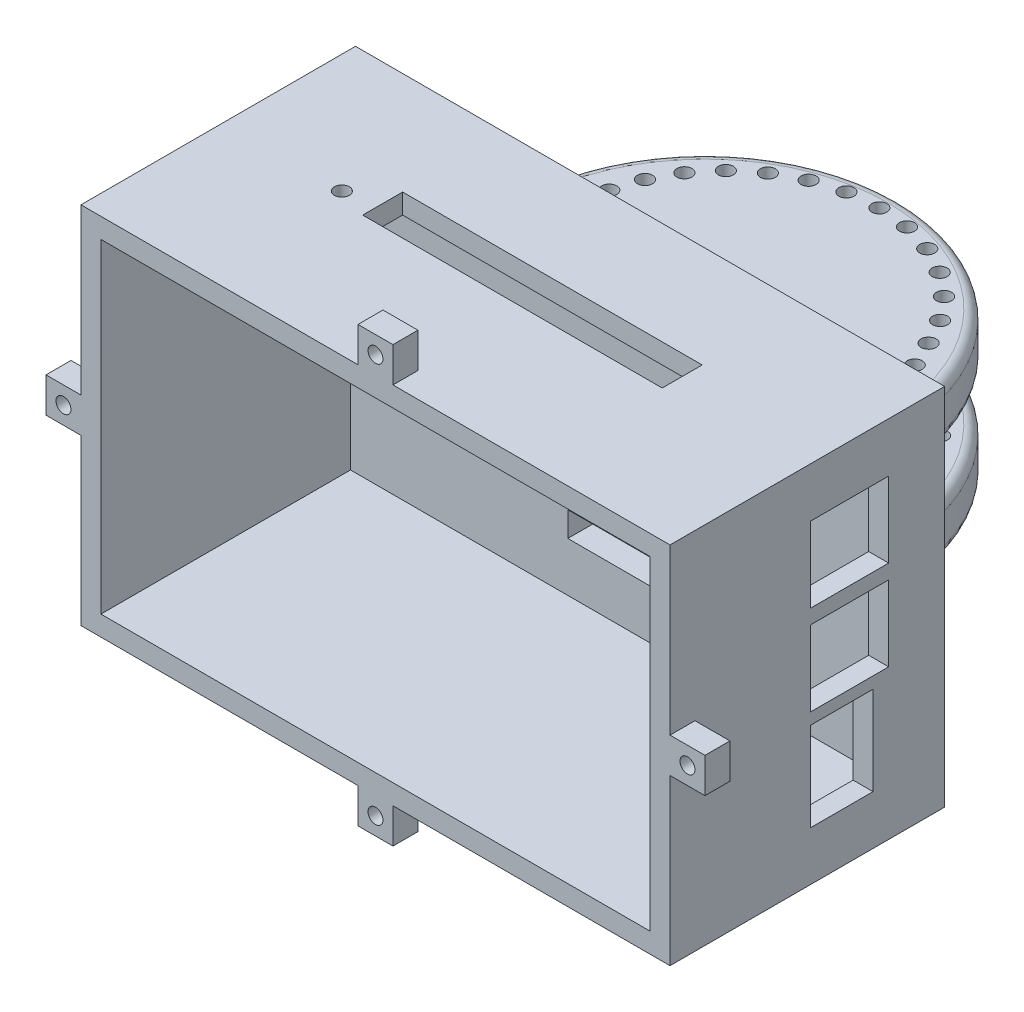
from build123d import *

# Parameters (mm, degrees)
CROQUIS1_W                    = 118
CROQUIS1_H                    = 73
SALIENTE_EXTRUIR1_DEPTH       = 100
SALIENTE_EXTRUIR2_START       = -86
SALIENTE_EXTRUIR2_OUTLINE_W   = 110
SALIENTE_EXTRUIR2_OUTLINE_H   = 65
SALIENTE_EXTRUIR2_DEPTH       = 86
SALIENTE_EXTRUIR3_START       = -9.489193536
SALIENTE_EXTRUIR3_OUTLINE_R   = 1.5
SALIENTE_EXTRUIR3_OUTLINE_R_2 = 11
SALIENTE_EXTRUIR3_DEPTH       = 9.489193536
CROQUIS4_W                    = 7
CROQUIS4_H                    = 7
CROQUIS4_R                    = 1.5
SALIENTE_EXTRUIR4_DEPTH       = 5
SALIENTE_EXTRUIR5_START       = -4
SALIENTE_EXTRUIR5_OUTLINE_W   = 12.57
SALIENTE_EXTRUIR5_OUTLINE_H   = 17.78
SALIENTE_EXTRUIR5_OUTLINE_W_2 = 15.7
SALIENTE_EXTRUIR5_OUTLINE_H_2 = 15.1
SALIENTE_EXTRUIR5_DEPTH       = 4
CROQUIS7_R                    = 1.5
CROQUIS7_W                    = 60
CROQUIS7_H                    = 8
CORTAR_EXTRUIR1_DEPTH         = 10
CROQUIS13_W                   = 50
CROQUIS13_H                   = 73
CORTAR_EXTRUIR3_DEPTH         = 135
CROQUIS14_W                   = 5
CROQUIS14_H                   = 73
SALIENTE_EXTRUIR8_DEPTH       = 118
SALIENTE_EXTRUIR9_DEPTH       = 15
SALIENTE_EXTRUIR9_DEPTH_BACK  = 15
CROQUIS16_R                   = 1.5
CORTAR_EXTRUIR4_DEPTH         = 5
CORTAR_EXTRUIR4_DEPTH_BACK    = 5
CROQUIS16_3_R                 = 1.5
REDONDEO4_R                   = 2
SALIENTE_EXTRUIR10_START      = -5
SALIENTE_EXTRUIR10_OUTLINE_W  = 20
SALIENTE_EXTRUIR10_OUTLINE_H  = 5
SALIENTE_EXTRUIR10_DEPTH      = 5


# Read off the part's stored shape, not the designer's step: Saliente-Extruir2, Saliente-Extruir3, Saliente-Extruir5, Saliente-Extruir10
with BuildPart() as part:
    # Croquis1 → Saliente-Extruir1 (new body)
    with BuildSketch(Plane(origin=(0, 6.22367504, 0), x_dir=(1, 0, 0), z_dir=(0, 0, 1))):
        with Locations((1.479192938, -15.901008827)):
            Rectangle(CROQUIS1_W, CROQUIS1_H)
    extrude(amount=SALIENTE_EXTRUIR1_DEPTH)

    # Saliente-Extruir2 outline → Saliente-Extruir2 (cut)
    with BuildSketch(Plane(origin=(0, 6.22367504, 100), x_dir=(1, 0, 0), z_dir=(0, 0, 1)).offset(SALIENTE_EXTRUIR2_START)):
        with Locations((1.479192938, -15.901008827)):
            Rectangle(SALIENTE_EXTRUIR2_OUTLINE_W, SALIENTE_EXTRUIR2_OUTLINE_H)
    extrude(amount=SALIENTE_EXTRUIR2_DEPTH, mode=Mode.SUBTRACT)

    # Saliente-Extruir3 outline → Saliente-Extruir3 (cut)
    with BuildSketch(Plane(origin=(0, 6.22367504, 0), x_dir=(-1, 0, 0), z_dir=(0, 0, -1)).offset(SALIENTE_EXTRUIR3_START)):
        with Locations((-16.979192938, -0.401008827)):
            Circle(SALIENTE_EXTRUIR3_OUTLINE_R)
        with Locations((14.020807062, -0.401008827)):
            Circle(SALIENTE_EXTRUIR3_OUTLINE_R)
        with Locations((-1.479192938, -15.901008827)):
            Circle(SALIENTE_EXTRUIR3_OUTLINE_R_2)
        with Locations((14.020807062, -31.401008827)):
            Circle(SALIENTE_EXTRUIR3_OUTLINE_R)
        with Locations((-16.979192938, -31.401008827)):
            Circle(SALIENTE_EXTRUIR3_OUTLINE_R)
    extrude(amount=SALIENTE_EXTRUIR3_DEPTH, mode=Mode.SUBTRACT)

    # Croquis4 → Saliente-Extruir4 (add)
    # profile 1 of 4: a face of its own
    with BuildSketch(Plane(origin=(0, 6.22367504, 100), x_dir=(1, 0, 0), z_dir=(0, 0, 1))):
        with Locations((1.479192938, 24.098991173)):
            Rectangle(CROQUIS4_W, CROQUIS4_H)
        with Locations((1.479192938, 24.098991173)):
            Circle(CROQUIS4_R, mode=Mode.SUBTRACT)
    # profile 2 of 4: a face of its own
    with BuildSketch(Plane(origin=(0, 6.22367504, 100), x_dir=(1, 0, 0), z_dir=(0, 0, 1))):
        with Locations((-61.020807062, -15.901008827)):
            Rectangle(CROQUIS4_W, CROQUIS4_H)
        with Locations((-61.020807062, -15.901008827)):
            Circle(CROQUIS4_R, mode=Mode.SUBTRACT)
    # profile 3 of 4: a face of its own
    with BuildSketch(Plane(origin=(0, 6.22367504, 100), x_dir=(1, 0, 0), z_dir=(0, 0, 1))):
        with Locations((1.479192938, -55.901008827)):
            Rectangle(CROQUIS4_W, CROQUIS4_H)
        with Locations((1.479192938, -55.901008827)):
            Circle(CROQUIS4_R, mode=Mode.SUBTRACT)
    # profile 4 of 4: a face of its own
    with BuildSketch(Plane(origin=(0, 6.22367504, 100), x_dir=(1, 0, 0), z_dir=(0, 0, 1))):
        with Locations((63.979192938, -15.901008827)):
            Rectangle(CROQUIS4_W, CROQUIS4_H)
        with Locations((63.979192938, -15.901008827)):
            Circle(CROQUIS4_R, mode=Mode.SUBTRACT)
    extrude(amount=-SALIENTE_EXTRUIR4_DEPTH)

    # Saliente-Extruir5 outline → Saliente-Extruir5 (cut)
    with BuildSketch(Plane(origin=(60.479192938, 6.22367504, 0), x_dir=(0, 0, -1), z_dir=(1, 0, 0)).offset(SALIENTE_EXTRUIR5_START)):
        with Locations((-65.615, -33.651008827)):
            Rectangle(SALIENTE_EXTRUIR5_OUTLINE_W, SALIENTE_EXTRUIR5_OUTLINE_H)
        with Locations((-64.05, -14.901008827)):
            Rectangle(SALIENTE_EXTRUIR5_OUTLINE_W_2, SALIENTE_EXTRUIR5_OUTLINE_H_2)
        with Locations((-64.05, 3.098991173)):
            Rectangle(SALIENTE_EXTRUIR5_OUTLINE_W_2, SALIENTE_EXTRUIR5_OUTLINE_H_2)
    extrude(amount=SALIENTE_EXTRUIR5_DEPTH, mode=Mode.SUBTRACT)

    # Croquis7 → Cortar-Extruir1 (cut)
    with BuildSketch(Plane(origin=(0, 26.822666212, 0), x_dir=(1, 0, 0), z_dir=(0, 1, 0))):
        with Locations(Location((-33.770807062, -71.48, 0), (0, 0, 270))):
            Circle(CROQUIS7_R)
        with Locations((2.479192938, -69.56)):
            Rectangle(CROQUIS7_W, CROQUIS7_H)
    extrude(amount=-CORTAR_EXTRUIR1_DEPTH, mode=Mode.SUBTRACT)

    # Croquis13 → Cortar-Extruir3 (cut)
    with BuildSketch(Plane(origin=(60.479192938, 6.22367504, 0), x_dir=(0, 0, -1), z_dir=(1, 0, 0))):
        with Locations((-25, -15.901008827)):
            Rectangle(CROQUIS13_W, CROQUIS13_H)
    extrude(amount=-CORTAR_EXTRUIR3_DEPTH, mode=Mode.SUBTRACT)

    # Croquis14 → Saliente-Extruir8 (add)
    with BuildSketch(Plane(origin=(60.479192938, 6.22367504, 0), x_dir=(0, 0, -1), z_dir=(1, 0, 0))):
        with Locations((-47.5, -15.901008827)):
            Rectangle(CROQUIS14_W, CROQUIS14_H)
    extrude(amount=-SALIENTE_EXTRUIR8_DEPTH)

    # Croquis16 → Saliente-Extruir9 (add, two sides: drawn at the far end of the back side and taken through both)
    with BuildSketch(Plane(origin=(0, -9.677333788, 0), x_dir=(1, 0, 0), z_dir=(0, 1, 0)).offset(-SALIENTE_EXTRUIR9_DEPTH_BACK)):
        with BuildLine():
            Line((-35.601799497, -45), (38.560185374, -45))
            ThreePointArc((38.560185374, -45), (1.479192938, 4.678159212), (-35.601799497, -45))
        make_face()
        with Locations(Location((1.479192938, -34, 0), (0, 0, 270))):
            Circle(CROQUIS16_R, mode=Mode.SUBTRACT)
        with Locations(Location((34.26638556, -34, 0), (0, 0, 270))):
            Circle(CROQUIS16_R, mode=Mode.SUBTRACT)
        with Locations(Location((33.768274431, -28.30656375, 0), (0, 0, 270))):
            Circle(CROQUIS16_R, mode=Mode.SUBTRACT)
        with Locations(Location((32.289075901, -22.78611968, 0), (0, 0, 270))):
            Circle(CROQUIS16_R, mode=Mode.SUBTRACT)
        with Locations(Location((29.873734667, -17.606403689, 0), (0, 0, 270))):
            Circle(CROQUIS16_R, mode=Mode.SUBTRACT)
        with Locations(Location((27.091167836, -12.509001309, 0), (0, 0, 270))):
            Circle(CROQUIS16_R, mode=Mode.SUBTRACT)
        with Locations(Location((23.32275151, -7.967860597, 0), (0, 0, 270))):
            Circle(CROQUIS16_R, mode=Mode.SUBTRACT)
        with Locations(Location((18.689710225, -4.190509634, 0), (0, 0, 270))):
            Circle(CROQUIS16_R, mode=Mode.SUBTRACT)
        with Locations(Location((13.361170535, -1.354534854, 0), (0, 0, 270))):
            Circle(CROQUIS16_R, mode=Mode.SUBTRACT)
        with Locations(Location((7.545562452, 0.404091135, 0), (0, 0, 270))):
            Circle(CROQUIS16_R, mode=Mode.SUBTRACT)
        with Locations(Location((1.479192938, 0.934829696, 0), (0, 0, 270))):
            Circle(CROQUIS16_R, mode=Mode.SUBTRACT)
        with Locations(Location((-29.779317156, -34, 0), (0, 0, 90))):
            Circle(CROQUIS16_R, mode=Mode.SUBTRACT)
        with Locations(Location((-29.30443015, -28.572016686, 0), (0, 0, 90))):
            Circle(CROQUIS16_R, mode=Mode.SUBTRACT)
        with Locations(Location((-28.643870833, -23.036101422, 0), (0, 0, 90))):
            Circle(CROQUIS16_R, mode=Mode.SUBTRACT)
        with Locations(Location((-26.915348791, -17.606403689, 0), (0, 0, 90))):
            Circle(CROQUIS16_R, mode=Mode.SUBTRACT)
        with Locations(Location((-24.13278196, -12.509001309, 0), (0, 0, 90))):
            Circle(CROQUIS16_R, mode=Mode.SUBTRACT)
        with Locations(Location((-20.364365633, -7.967860597, 0), (0, 0, 90))):
            Circle(CROQUIS16_R, mode=Mode.SUBTRACT)
        with Locations(Location((-15.731324349, -4.190509634, 0), (0, 0, 90))):
            Circle(CROQUIS16_R, mode=Mode.SUBTRACT)
        with Locations(Location((-10.402784659, -1.354534854, 0), (0, 0, 90))):
            Circle(CROQUIS16_R, mode=Mode.SUBTRACT)
        with Locations(Location((-4.587176576, 0.404091135, 0), (0, 0, 90))):
            Circle(CROQUIS16_R, mode=Mode.SUBTRACT)
    extrude(amount=SALIENTE_EXTRUIR9_DEPTH + SALIENTE_EXTRUIR9_DEPTH_BACK)

    # Croquis16<3> → Cortar-Extruir4 (cut, two sides: drawn at the far end of the back side and taken through both)
    with BuildSketch(Plane(origin=(0, -9.677333788, 0), x_dir=(1, 0, 0), z_dir=(0, 1, 0)).offset(-CORTAR_EXTRUIR4_DEPTH_BACK)):
        with BuildLine():
            Line((-35.601799497, -45), (38.560185374, -45))
            ThreePointArc((38.560185374, -45), (1.479192938, 4.678159212), (-35.601799497, -45))
        make_face()
        with Locations(Location((1.479192938, -34, 0), (0, 0, 270))):
            Circle(CROQUIS16_3_R, mode=Mode.SUBTRACT)
        with Locations(Location((34.26638556, -34, 0), (0, 0, 270))):
            Circle(CROQUIS16_3_R, mode=Mode.SUBTRACT)
        with Locations(Location((33.768274431, -28.30656375, 0), (0, 0, 270))):
            Circle(CROQUIS16_3_R, mode=Mode.SUBTRACT)
        with Locations(Location((32.289075901, -22.78611968, 0), (0, 0, 270))):
            Circle(CROQUIS16_3_R, mode=Mode.SUBTRACT)
        with Locations(Location((29.873734667, -17.606403689, 0), (0, 0, 270))):
            Circle(CROQUIS16_3_R, mode=Mode.SUBTRACT)
        with Locations(Location((27.091167836, -12.509001309, 0), (0, 0, 270))):
            Circle(CROQUIS16_3_R, mode=Mode.SUBTRACT)
        with Locations(Location((23.32275151, -7.967860597, 0), (0, 0, 270))):
            Circle(CROQUIS16_3_R, mode=Mode.SUBTRACT)
        with Locations(Location((18.689710225, -4.190509634, 0), (0, 0, 270))):
            Circle(CROQUIS16_3_R, mode=Mode.SUBTRACT)
        with Locations(Location((13.361170535, -1.354534854, 0), (0, 0, 270))):
            Circle(CROQUIS16_3_R, mode=Mode.SUBTRACT)
        with Locations(Location((7.545562452, 0.404091135, 0), (0, 0, 270))):
            Circle(CROQUIS16_3_R, mode=Mode.SUBTRACT)
        with Locations(Location((1.479192938, 0.934829696, 0), (0, 0, 270))):
            Circle(CROQUIS16_3_R, mode=Mode.SUBTRACT)
        with Locations(Location((-29.779317156, -34, 0), (0, 0, 90))):
            Circle(CROQUIS16_3_R, mode=Mode.SUBTRACT)
        with Locations(Location((-29.30443015, -28.572016686, 0), (0, 0, 90))):
            Circle(CROQUIS16_3_R, mode=Mode.SUBTRACT)
        with Locations(Location((-28.643870833, -23.036101422, 0), (0, 0, 90))):
            Circle(CROQUIS16_3_R, mode=Mode.SUBTRACT)
        with Locations(Location((-26.915348791, -17.606403689, 0), (0, 0, 90))):
            Circle(CROQUIS16_3_R, mode=Mode.SUBTRACT)
        with Locations(Location((-24.13278196, -12.509001309, 0), (0, 0, 90))):
            Circle(CROQUIS16_3_R, mode=Mode.SUBTRACT)
        with Locations(Location((-20.364365633, -7.967860597, 0), (0, 0, 90))):
            Circle(CROQUIS16_3_R, mode=Mode.SUBTRACT)
        with Locations(Location((-15.731324349, -4.190509634, 0), (0, 0, 90))):
            Circle(CROQUIS16_3_R, mode=Mode.SUBTRACT)
        with Locations(Location((-10.402784659, -1.354534854, 0), (0, 0, 90))):
            Circle(CROQUIS16_3_R, mode=Mode.SUBTRACT)
        with Locations(Location((-4.587176576, 0.404091135, 0), (0, 0, 90))):
            Circle(CROQUIS16_3_R, mode=Mode.SUBTRACT)
    extrude(amount=CORTAR_EXTRUIR4_DEPTH + CORTAR_EXTRUIR4_DEPTH_BACK, mode=Mode.SUBTRACT)

    # Redondeo4
    redondeo4_edges = [part.edges().sort_by_distance(p)[0] for p in [
        (1.479192938, -24.677333788, -4.678159212),
        (1.479192938, 5.322666212, -4.678159212),
        (1.479192938, -4.677333788, -4.678159212),
        (1.479192938, -14.677333788, -4.678159212),
    ]]
    fillet(redondeo4_edges, radius=REDONDEO4_R)

    # Saliente-Extruir10 outline → Saliente-Extruir10 (cut)
    with BuildSketch(Plane(origin=(0, 0, 45), x_dir=(-1, 0, 0), z_dir=(0, 0, -1)).offset(SALIENTE_EXTRUIR10_START)):
        with Locations((0, -29.797101415)):
            Rectangle(SALIENTE_EXTRUIR10_OUTLINE_W, SALIENTE_EXTRUIR10_OUTLINE_H)
    extrude(amount=SALIENTE_EXTRUIR10_DEPTH, mode=Mode.SUBTRACT)


solid = part.part
